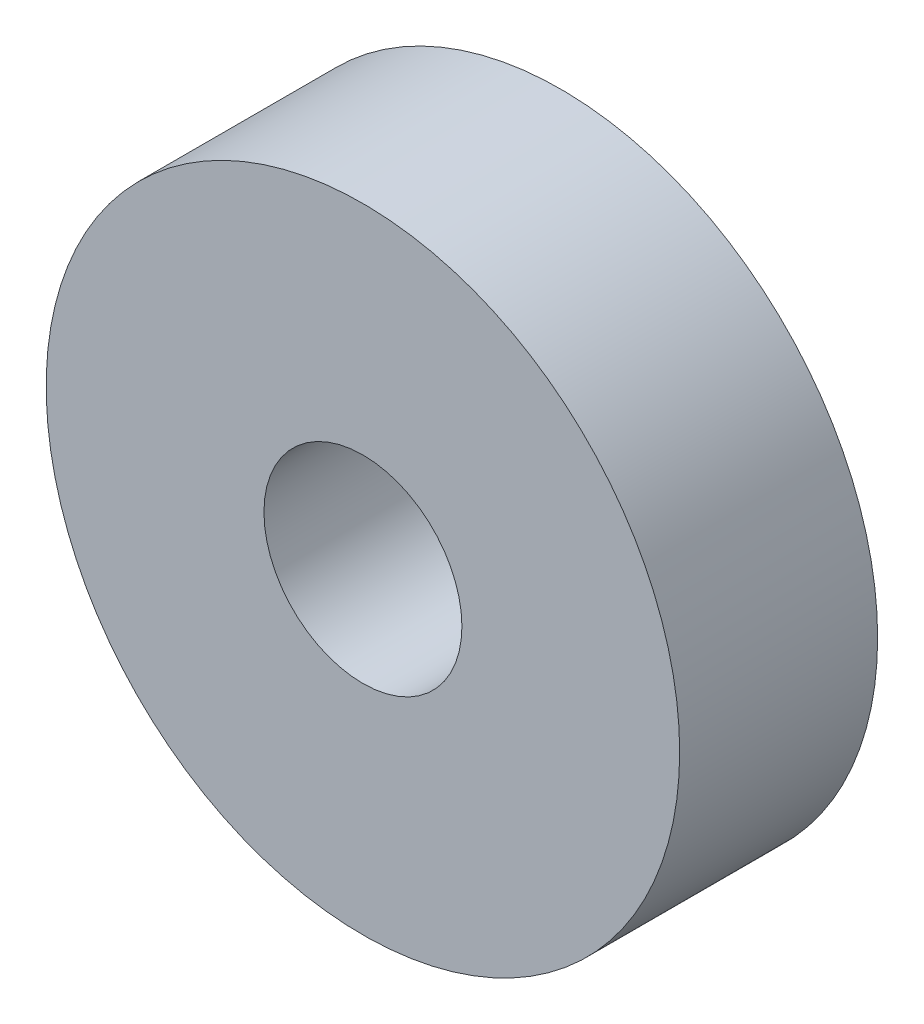
from build123d import *

# Parameters (mm, degrees)
SKIZZE1_R                       = 8
SKIZZE1_R_2                     = 2.5
AUFSATZ_LINEAR_AUSTRAGEN1_DEPTH = 2.5


with BuildPart() as part:
    # Skizze1 → Aufsatz-Linear austragen1 (new, symmetric)
    with BuildSketch(Plane.XY):
        Circle(SKIZZE1_R)
        Circle(SKIZZE1_R_2, mode=Mode.SUBTRACT)
    extrude(amount=AUFSATZ_LINEAR_AUSTRAGEN1_DEPTH, both=True)


solid = part.part
